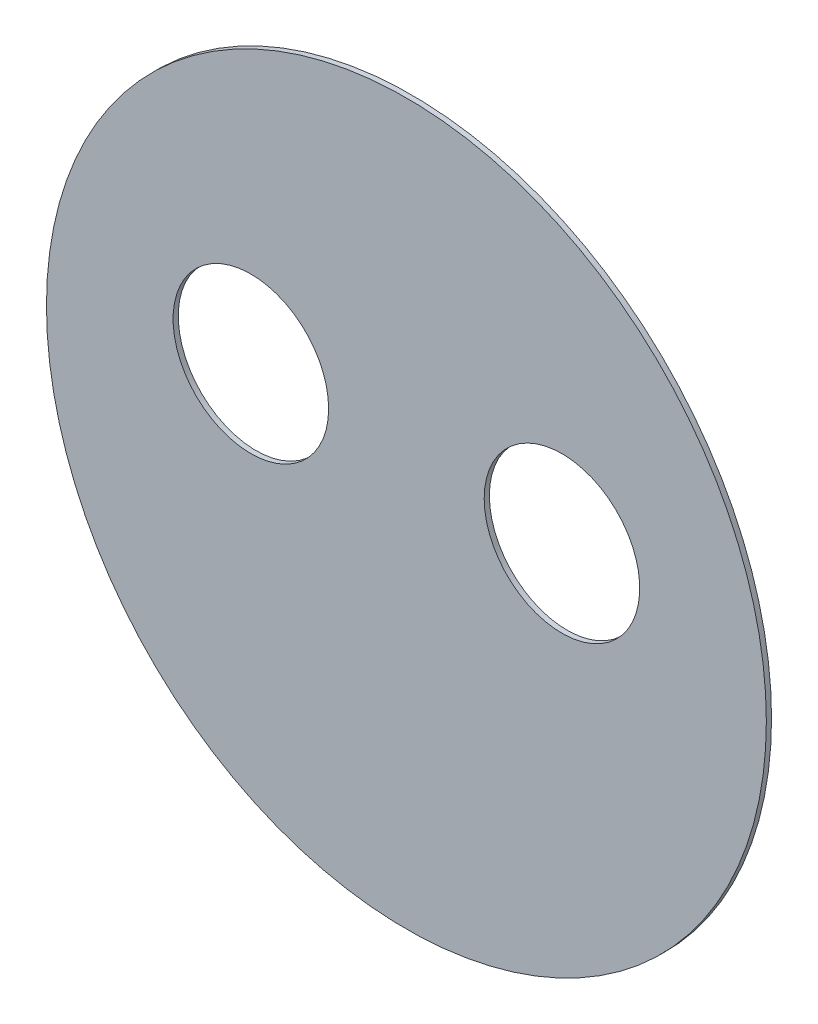
from build123d import *

# Parameters (mm, degrees)
SKETCH1_R           = 34.7111111
BOSS_EXTRUDE1_DEPTH = 0.5
SKETCH3_R           = 7.5
CUT_EXTRUDE1_DEPTH  = 50.091470416


with BuildPart() as part:
    # Sketch1 → Boss-Extrude1 (new body)
    with BuildSketch(Plane.XY):
        Circle(SKETCH1_R)
    extrude(amount=BOSS_EXTRUDE1_DEPTH)

    # Sketch3 → Cut-Extrude1 (cut, through all)
    with BuildSketch(Plane.XY.offset(0.5)):
        with Locations((-15, 5)):
            Circle(SKETCH3_R)
        with Locations((15, 5)):
            Circle(SKETCH3_R)
    extrude(amount=-CUT_EXTRUDE1_DEPTH, mode=Mode.SUBTRACT)


solid = part.part
